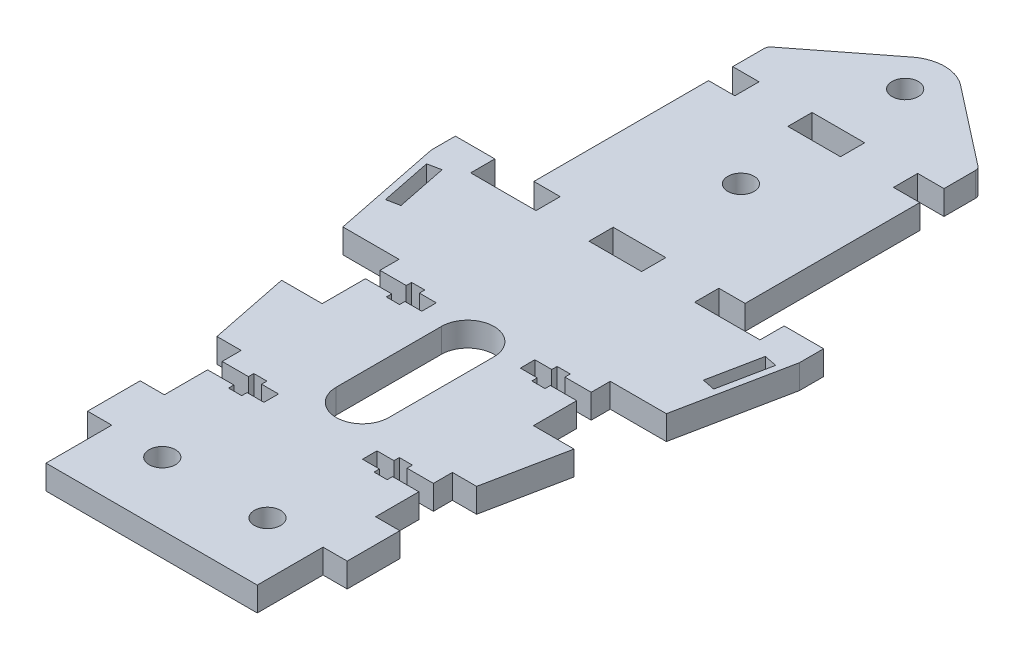
from build123d import *

# Parameters (mm, degrees)
SKETCH1_R           = 3.175
SKETCH1_W           = 12.7
SKETCH1_H           = 5.842
BOSS_EXTRUDE1_DEPTH = 5.842
CUT_EXTRUDE1_DEPTH  = 116.299365115
FILLET1_R           = 1.5875
CUT_EXTRUDE2_DEPTH  = 116.299365115


with BuildPart() as part:
    # Sketch1 → Boss-Extrude1 (new body)
    with BuildSketch(Plane(origin=(0, 0, 0), x_dir=(1, 0, 0), z_dir=(0, 1, 0))):
        with BuildLine():
            Line((31.75, 26.724230903), (25.5, 26.724230903))
            Line((25.5, 26.724230903), (19.15, 26.724230903))
            Line((19.15, 26.724230903), (19.15, 32.566230903))
            Line((19.15, 32.566230903), (25.5, 32.566230903))
            Line((25.5, 32.566230903), (25.5, 74.730230903))
            Line((25.5, 74.730230903), (19.15, 74.730230903))
            Line((19.15, 74.730230903), (19.15, 80.572230903))
            Line((19.15, 80.572230903), (25.5, 80.572230903))
            Line((25.5, 80.572230903), (25.5, 88.9))
            Line((25.5, 88.9), (5.856060063, 104.213366787))
            ThreePointArc((5.856060063, 104.213366787), (0, 106.226230903), (-5.856060063, 104.213366787))
            Line((-5.856060063, 104.213366787), (-25.5, 88.9))
            Line((-25.5, 88.9), (-25.5, 80.572230903))
            Line((-25.5, 80.572230903), (-19.15, 80.572230903))
            Line((-19.15, 80.572230903), (-19.15, 74.730230903))
            Line((-19.15, 74.730230903), (-25.5, 74.730230903))
            Line((-25.5, 74.730230903), (-25.5, 32.566230903))
            Line((-25.5, 32.566230903), (-19.15, 32.566230903))
            Line((-19.15, 32.566230903), (-19.15, 26.724230903))
            Line((-19.15, 26.724230903), (-25.5, 26.724230903))
            Line((-25.5, 26.724230903), (-31.75, 26.724230903))
            Line((-31.75, 26.724230903), (-34.925, 26.724230903))
            Line((-34.925, 26.724230903), (-34.925, 32.566230903))
            Line((-34.925, 32.566230903), (-44.45, 32.566230903))
            Line((-44.45, 32.566230903), (-44.45, 26.724230903))
            Line((-44.45, 26.724230903), (-39.046137682, 0))
            Line((-39.046137682, 0), (-31.342, 0))
            Line((-31.342, 0), (-25.5, 0))
            Line((-25.5, 0), (-25.5, -18.542))
            Line((-25.5, -18.542), (-31.342, -18.542))
            Line((-31.342, -18.542), (-35.296790677, -18.542))
            Line((-35.296790677, -18.542), (-31.342, -38.1))
            Line((-31.342, -38.1), (-25.5, -38.1))
            Line((-25.5, -38.1), (-25.5, -56.642))
            Line((-25.5, -56.642), (-31.342, -56.642))
            Line((-31.342, -56.642), (-31.342, -69.342))
            Line((-31.342, -69.342), (-25.5, -69.342))
            Line((-25.5, -69.342), (-25.5, -85.217))
            Line((-25.5, -85.217), (25.5, -85.217))
            Line((25.5, -85.217), (25.5, -69.342))
            Line((25.5, -69.342), (31.342, -69.342))
            Line((31.342, -69.342), (31.342, -56.642))
            Line((31.342, -56.642), (25.5, -56.642))
            Line((25.5, -56.642), (25.5, -38.1))
            Line((25.5, -38.1), (31.342, -38.1))
            Line((31.342, -38.1), (35.296790677, -18.542))
            Line((35.296790677, -18.542), (31.342, -18.542))
            Line((31.342, -18.542), (25.5, -18.542))
            Line((25.5, -18.542), (25.5, 0))
            Line((25.5, 0), (31.342, 0))
            Line((31.342, 0), (39.046137682, 0))
            Line((39.046137682, 0), (44.45, 26.724230903))
            Line((44.45, 26.724230903), (44.45, 32.566230903))
            Line((44.45, 32.566230903), (34.925, 32.566230903))
            Line((34.925, 32.566230903), (34.925, 26.724230903))
            Line((34.925, 26.724230903), (31.75, 26.724230903))
        make_face()
        with Locations((0, 96.701230903)):
            Circle(SKETCH1_R, mode=Mode.SUBTRACT)
        with Locations((0, 57.053608903)):
            Circle(SKETCH1_R, mode=Mode.SUBTRACT)
        with Locations((-12.7, -69.946391097)):
            Circle(SKETCH1_R, mode=Mode.SUBTRACT)
        with Locations((12.7, -69.946391097)):
            Circle(SKETCH1_R, mode=Mode.SUBTRACT)
        with Locations((0, 77.651230903)):
            Rectangle(SKETCH1_W, SKETCH1_H, mode=Mode.SUBTRACT)
        with BuildLine():
            Line((6.35, -8.911080097), (6.35, -34.311080097))
            ThreePointArc((6.35, -34.311080097), (0, -40.661080097), (-6.35, -34.311080097))
            Line((-6.35, -34.311080097), (-6.35, -8.911080097))
            ThreePointArc((-6.35, -8.911080097), (0, -2.561080097), (6.35, -8.911080097))
        make_face(mode=Mode.SUBTRACT)
        with Locations((0, 29.645230903)):
            Rectangle(SKETCH1_W, SKETCH1_H, mode=Mode.SUBTRACT)
    extrude(amount=BOSS_EXTRUDE1_DEPTH)

    # Sketch2 → Cut-Extrude1 (cut, through all)
    with BuildSketch(Plane(origin=(0, 5.842, 0), x_dir=(1, 0, 0), z_dir=(0, 1, 0))):
        Polygon((-15.975, -42.6974), (-15.975, -41.402), (-19.15, -41.402), (-19.15, -42.6974), (-25.5, -42.6974), (-25.5, -46.2026), (-19.15, -46.2026), (-19.15, -47.498), (-15.975, -47.498), (-15.975, -46.2026), (-11.891999892, -46.2026), (-11.891999892, -42.6974), align=None)
        Polygon((-19.15, -8.1026), (-19.15, -9.398), (-15.975, -9.398), (-15.975, -8.1026), (-11.891999892, -8.1026), (-11.891999892, -4.5974), (-15.975, -4.5974), (-15.975, -3.302), (-19.15, -3.302), (-19.15, -4.5974), (-25.5, -4.5974), (-25.5, -8.1026), align=None)
        Polygon((15.975, -8.1026), (15.975, -9.398), (19.15, -9.398), (19.15, -8.1026), (25.5, -8.1026), (25.5, -4.5974), (19.15, -4.5974), (19.15, -3.302), (15.975, -3.302), (15.975, -4.5974), (11.891999892, -4.5974), (11.891999892, -8.1026), align=None)
        Polygon((19.15, -42.6974), (19.15, -41.402), (15.975, -41.402), (15.975, -42.6974), (11.891999892, -42.6974), (11.891999892, -46.2026), (15.975, -46.2026), (15.975, -47.498), (19.15, -47.498), (19.15, -46.2026), (25.5, -46.2026), (25.5, -42.6974), align=None)
    extrude(amount=-CUT_EXTRUDE1_DEPTH, mode=Mode.SUBTRACT)

    # Fillet1
    fillet1_edges = [part.edges().sort_by_distance(p)[0] for p in [
        (25.5, 2.921, -88.9),
        (-25.5, 2.921, -88.9),
    ]]
    fillet(fillet1_edges, radius=FILLET1_R)

    # Sketch3 → Cut-Extrude2 (cut, through all)
    with BuildSketch(Plane(origin=(0, 5.842, 0), x_dir=(1, 0, 0), z_dir=(0, 1, 0))):
        Polygon((-42.137472374, 23.29757819), (-39.620370832, 10.849518107), (-36.508355811, 11.478793492), (-39.025457353, 23.926853575), align=None)
        Polygon((39.025457353, 23.926853575), (36.508355811, 11.478793492), (39.620370832, 10.849518107), (42.137472374, 23.29757819), align=None)
    extrude(amount=-CUT_EXTRUDE2_DEPTH, mode=Mode.SUBTRACT)


solid = part.part
